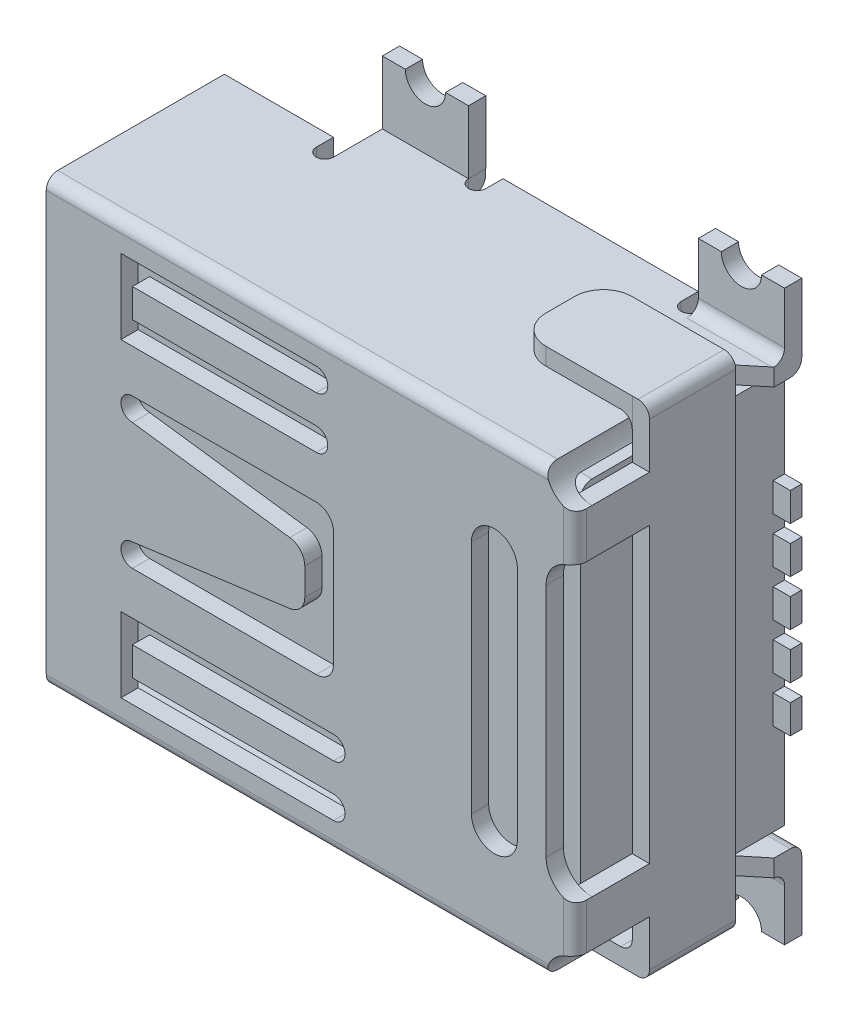
from build123d import *

# Parameters (mm, degrees)
EXTRUDE1_DEPTH       = 3.95
FILLET1_R            = 0.2
FILLET2_R            = 0.2
SKETCH2_W            = 3.65
SKETCH2_H            = 7.1
CUT_EXTRUDE1_DEPTH   = 9.2
FILLET5_R            = 0.2
FILLET9_R            = 0.2
SKETCH4_W            = 1.5
SKETCH4_H            = 0.3
EXTRUDE3_DEPTH       = 1.1
FILLET10_R           = 0.2
CUT_EXTRUDE2_DEPTH   = 0.3
SKETCH6_W            = 1.5
SKETCH6_H            = 0.3
EXTRUDE4_DEPTH       = 1.1
CUT_EXTRUDE4_DEPTH   = 0.3
CUT_EXTRUDE5_DEPTH   = 0.3
FILLET11_R           = 0.2
CUT_EXTRUDE6_DEPTH   = 0.3
FILLET12_R           = 0.2
SKETCH11_W           = 1
SKETCH11_H           = 0.8
EXTRUDE5_DEPTH       = 0.3
FILLET13_R           = 0.2
SKETCH12_W           = 1
SKETCH12_H           = 0.8
EXTRUDE6_DEPTH       = 0.3
FILLET14_R           = 0.2
EXTRUDE7_DEPTH       = 1.5
EXTRUDE8_DEPTH       = 1
SKETCH15_W           = 0.3
SKETCH15_H           = 1.5
EXTRUDE9_DEPTH       = 1
SKETCH16_W           = 1.500002194
SKETCH16_H           = 0.3
EXTRUDE10_DEPTH      = 2
FILLET15_R           = 0.2
FILLET17_R           = 0.2
SKETCH17_W           = 1.5
SKETCH17_H           = 0.3
EXTRUDE11_DEPTH      = 2
FILLET18_R           = 0.2
FILLET19_R           = 0.2
FILLET20_R           = 0.5
FILLET21_R           = 0.5
FILLET22_R           = 0.5
FILLET23_R           = 0.5
CUT_EXTRUDE8_DEPTH   = 0.3
CUT_EXTRUDE9_DEPTH   = 0.3
EXTRUDE12_DEPTH      = 0.3
EXTRUDE13_DEPTH      = 0.3
SKETCH22_W           = 1.5
SKETCH22_H           = 0.3
EXTRUDE14_DEPTH      = 1.1
CUT_EXTRUDE10_DEPTH  = 0.3
FILLET24_R           = 0.2
FILLET25_R           = 0.2
SKETCH24_W           = 1.5
SKETCH24_H           = 0.3
EXTRUDE15_DEPTH      = 1.1
CUT_EXTRUDE11_START  = -0.3
CUT_EXTRUDE11_DEPTH  = 0.3
CUT_EXTRUDE12_DEPTH  = 0.3
FILLET26_R           = 0.2
FILLET27_R           = 0.2
CUT_EXTRUDE13_DEPTH  = 0.3
SKETCH29_W           = 1.9
SKETCH29_H           = 0.025
EXTRUDE16_DEPTH      = 0.3
EXTRUDE17_DEPTH      = 8.9
EXTRUDE18_DEPTH      = 1
EXTRUDE18_DEPTH_BACK = 1
SKETCH31_R           = 0.346423802
CUT_EXTRUDE14_DEPTH  = 2.5
CUT_EXTRUDE15_DEPTH  = 1
SKETCH35_W           = 1.45
SKETCH35_H           = 0.4
EXTRUDE19_DEPTH      = 2
SKETCH36_W           = 1.05
SKETCH36_H           = 6.9
EXTRUDE20_DEPTH      = 7
SKETCH37_W           = 0.2
SKETCH37_H           = 0.5
CUT_EXTRUDE16_DEPTH  = 2
SKETCH38_W           = 2.3
SKETCH38_H           = 0.5
EXTRUDE21_DEPTH      = 0.2


with BuildPart() as part:
    # Sketch1 → Extrude1 (new body)
    with BuildSketch(Plane.XY):
        with BuildLine():
            Line((0, 0), (8.7, 0))
            ThreePointArc((8.7, 0), (8.846446609, 0.353553391), (9.2, 0.5))
            Line((9.2, 0.5), (9.2, 1.3))
            ThreePointArc((9.2, 1.3), (8.846446609, 1.446446609), (8.7, 1.8))
            Line((8.7, 1.8), (8.7, 5.9))
            ThreePointArc((8.7, 5.9), (8.846446609, 6.253553391), (9.2, 6.4))
            Line((9.2, 6.4), (9.2, 7.2))
            ThreePointArc((9.2, 7.2), (8.846446609, 7.346446609), (8.7, 7.7))
            Line((8.7, 7.7), (0, 7.7))
            Line((0, 7.7), (0, 0))
        make_face()
        with BuildLine():
            Line((8.2, 1.8), (8.2, 5.9))
            ThreePointArc((8.2, 5.9), (7.8, 6.3), (7.4, 5.9))
            Line((7.4, 5.9), (7.4, 1.8))
            ThreePointArc((7.4, 1.8), (7.8, 1.4), (8.2, 1.8))
        make_face(mode=Mode.SUBTRACT)
        with BuildLine():
            Line((5, 4.85), (5, 2.85))
            ThreePointArc((5, 2.85), (4.912132034, 2.637867966), (4.7, 2.55))
            Line((4.7, 2.55), (1.5, 2.55))
            ThreePointArc((1.5, 2.55), (1.3, 2.75), (1.5, 2.95))
            Line((1.5, 2.95), (4.239649116, 3.315286549))
            ThreePointArc((4.239649116, 3.315286549), (4.425715235, 3.41503753), (4.5, 3.612654919))
            Line((4.5, 3.612654919), (4.5, 4.087345081))
            ThreePointArc((4.5, 4.087345081), (4.425715235, 4.28496247), (4.239649116, 4.384713451))
            Line((4.239649116, 4.384713451), (1.5, 4.75))
            ThreePointArc((1.5, 4.75), (1.3, 4.95), (1.5, 5.15))
            Line((1.5, 5.15), (4.7, 5.15))
            ThreePointArc((4.7, 5.15), (4.912132034, 5.062132034), (5, 4.85))
        make_face(mode=Mode.SUBTRACT)
        with BuildLine():
            Line((1.3, 5.9), (4.7, 5.9))
            ThreePointArc((4.7, 5.9), (4.9, 6.1), (4.7, 6.3))
            Line((4.7, 6.3), (1.5, 6.3))
            Line((1.5, 6.3), (1.5, 6.8))
            Line((1.5, 6.8), (4.7, 6.8))
            ThreePointArc((4.7, 6.8), (4.9, 7), (4.7, 7.2))
            Line((4.7, 7.2), (1.3, 7.2))
            Line((1.3, 7.2), (1.3, 5.9))
        make_face(mode=Mode.SUBTRACT)
        with BuildLine():
            Line((5, 1.8), (1.3, 1.8))
            Line((1.3, 1.8), (1.3, 0.5))
            Line((1.3, 0.5), (5, 0.5))
            ThreePointArc((5, 0.5), (5.2, 0.7), (5, 0.9))
            Line((5, 0.9), (1.5, 0.9))
            Line((1.5, 0.9), (1.5, 1.4))
            Line((1.5, 1.4), (5, 1.4))
            ThreePointArc((5, 1.4), (5.2, 1.6), (5, 1.8))
        make_face(mode=Mode.SUBTRACT)
    extrude(amount=EXTRUDE1_DEPTH)

    # Fillet1
    fillet1_edges = [part.edges().sort_by_distance(p)[0] for p in [
        (4.35, 7.7, 3.95),
    ]]
    fillet(fillet1_edges, radius=FILLET1_R)

    # Fillet2
    fillet2_edges = [part.edges().sort_by_distance(p)[0] for p in [
        (4.35, 0, 3.95),
    ]]
    fillet(fillet2_edges, radius=FILLET2_R)

    # Sketch2 → Cut-Extrude1 (cut)
    with BuildSketch(Plane.ZY):
        with Locations((1.825, 3.85)):
            Rectangle(SKETCH2_W, SKETCH2_H)
    extrude(amount=-CUT_EXTRUDE1_DEPTH, mode=Mode.SUBTRACT)

    # Fillet5
    fillet5_edges = [part.edges().sort_by_distance(p)[0] for p in [
        (4.4, 7.4, 3.65),
    ]]
    fillet(fillet5_edges, radius=FILLET5_R - 0.0001)  # a hair under: the kernel refuses the full size

    # Fillet9
    fillet9_edges = [part.edges().sort_by_distance(p)[0] for p in [
        (4.4, 0.3, 3.65),
    ]]
    fillet(fillet9_edges, radius=FILLET9_R - 0.0001)  # a hair under: the kernel refuses the full size

    # Sketch4 → Extrude3 (add)
    with BuildSketch(Plane.XZ):
        with Locations((2.95, 0.15)):
            Rectangle(SKETCH4_W, SKETCH4_H)
    extrude(amount=EXTRUDE3_DEPTH)

    # Fillet10
    fillet10_edges = [part.edges().sort_by_distance(p)[0] for p in [
        (2.95, 0, 0.3),
    ]]
    fillet(fillet10_edges, radius=FILLET10_R)

    # Sketch5 → Cut-Extrude2 (cut)
    with BuildSketch(Plane.XZ):
        with BuildLine():
            Line((0, 0), (0, 0.85))
            Line((0, 0.85), (1.9, 0.85))
            Line((1.9, 0.85), (1.9, 1.35))
            ThreePointArc((1.9, 1.35), (2.05, 1.5), (2.2, 1.35))
            Line((2.2, 1.35), (2.2, 0))
            Line((2.2, 0), (0, 0))
        make_face()
    extrude(amount=-CUT_EXTRUDE2_DEPTH, mode=Mode.SUBTRACT)

    # Sketch6 → Extrude4 (add)
    with BuildSketch(Plane(origin=(0, 7.7, 0), x_dir=(-1, 0, 0), z_dir=(0, 1, 0))):
        with Locations((-2.95, 0.15)):
            Rectangle(SKETCH6_W, SKETCH6_H)
    extrude(amount=EXTRUDE4_DEPTH)

    # Sketch8 → Cut-Extrude4 (cut)
    with BuildSketch(Plane(origin=(0, 7.7, 0), x_dir=(-1, 0, 0), z_dir=(0, 1, 0))):
        with BuildLine():
            Line((0, 0), (0, 0.875))
            Line((0, 0.875), (-1.9, 0.875))
            Line((-1.9, 0.875), (-1.9, 1.15))
            ThreePointArc((-1.9, 1.15), (-2.05, 1.3), (-2.2, 1.15))
            Line((-2.2, 1.15), (-2.2, 0.3))
            Line((-2.2, 0.3), (-2.2, 0))
            Line((-2.2, 0), (0, 0))
        make_face()
    extrude(amount=-CUT_EXTRUDE4_DEPTH, mode=Mode.SUBTRACT)

    # Sketch9 → Cut-Extrude5 (cut)
    with BuildSketch(Plane.XZ):
        with BuildLine():
            Line((3.7, 0), (3.7, 0.5))
            ThreePointArc((3.7, 0.5), (3.85, 0.65), (4, 0.5))
            Line((4, 0.5), (4, 0))
            Line((4, 0), (3.7, 0))
        make_face()
    extrude(amount=-CUT_EXTRUDE5_DEPTH, mode=Mode.SUBTRACT)

    # Fillet11
    fillet11_edges = [part.edges().sort_by_distance(p)[0] for p in [
        (2.95, 0.3, 0),
    ]]
    fillet(fillet11_edges, radius=FILLET11_R)

    # Sketch10 → Cut-Extrude6 (cut)
    with BuildSketch(Plane(origin=(0, 7.7, 0), x_dir=(-1, 0, 0), z_dir=(0, 1, 0))):
        with BuildLine():
            Line((-3.696750436, 0), (-3.7, 0.3))
            ThreePointArc((-3.7, 0.3), (-3.851615888, 0.448366514), (-3.999982402, 0.296750627))
            Line((-3.999982402, 0.296750627), (-3.999982402, 0))
            Line((-3.999982402, 0), (-3.696750436, 0))
        make_face()
    extrude(amount=-CUT_EXTRUDE6_DEPTH, mode=Mode.SUBTRACT)

    # Fillet12
    fillet12_edges = [part.edges().sort_by_distance(p)[0] for p in [
        (2.948375218, 7.4, 0),
    ]]
    fillet(fillet12_edges, radius=FILLET12_R)

    # Sketch11 → Extrude5 (add)
    with BuildSketch(Plane(origin=(9.2, 0, 0), x_dir=(0, 0, -1), z_dir=(1, 0, 0))):
        with Locations((-3.15, 6.8)):
            Rectangle(SKETCH11_W, SKETCH11_H)
    extrude(amount=-EXTRUDE5_DEPTH)

    # Fillet13
    fillet13_edges = [part.edges().sort_by_distance(p)[0] for p in [
        (9.2, 6.8, 3.95),
    ]]
    fillet(fillet13_edges, radius=FILLET13_R)

    # Sketch12 → Extrude6 (add)
    with BuildSketch(Plane(origin=(9.2, 0, 0), x_dir=(0, 0, -1), z_dir=(1, 0, 0))):
        with Locations((-3.15, 0.9)):
            Rectangle(SKETCH12_W, SKETCH12_H)
    extrude(amount=-EXTRUDE6_DEPTH)

    # Fillet14
    fillet14_edges = [part.edges().sort_by_distance(p)[0] for p in [
        (9.2, 0.9, 3.95),
    ]]
    fillet(fillet14_edges, radius=FILLET14_R)

    # Sketch13 → Extrude7 (add)
    with BuildSketch(Plane(origin=(0, 0, 2.65), x_dir=(-1, 0, 0), z_dir=(0, 0, -1))):
        Polygon((-9.2, 6.4), (-9.2, 1.3), (-9.2, 0.5), (-8.9, 0.5), (-8.9, 6.4), (-8.9, 7.2), (-9.2, 7.2), align=None)
    extrude(amount=EXTRUDE7_DEPTH)

    # Sketch14 → Extrude8 (add)
    with BuildSketch(Plane(origin=(0, 7.2, 0), x_dir=(-1, 0, 0), z_dir=(0, 1, 0))):
        Polygon((-9.2, 1.15), (-9.2, 2.65), (-8.9, 2.65), (-8.897434104, 1.15), align=None)
    extrude(amount=EXTRUDE8_DEPTH)

    # Sketch15 → Extrude9 (add)
    with BuildSketch(Plane.XZ.offset(-0.5)):
        with Locations((9.05, 1.9)):
            Rectangle(SKETCH15_W, SKETCH15_H)
    extrude(amount=EXTRUDE9_DEPTH)

    # Sketch16 → Extrude10 (add)
    with BuildSketch(Plane(origin=(8.895440887, 0, -0.015216519), x_dir=(0.0017105950011207093, 0, 0.9999985369313008), z_dir=(-0.9999985369313008, 2.168401172446543e-15, 0.0017105950011207093))):
        with Locations((1.915219321, 8.05)):
            Rectangle(SKETCH16_W, SKETCH16_H)
    extrude(amount=EXTRUDE10_DEPTH)

    # Fillet15
    fillet15_edges = [part.edges().sort_by_distance(p)[0] for p in [
        (9.2, 8.2, 1.9),
    ]]
    fillet(fillet15_edges, radius=FILLET15_R)

    # Fillet17
    fillet17_edges = [part.edges().sort_by_distance(p)[0] for p in [
        (8.898717052, 7.9, 1.9),
    ]]
    fillet(fillet17_edges, radius=FILLET17_R)

    # Sketch17 → Extrude11 (add)
    with BuildSketch(Plane.ZY.offset(-8.9)):
        with Locations((1.9, -0.35)):
            Rectangle(SKETCH17_W, SKETCH17_H)
    extrude(amount=EXTRUDE11_DEPTH)

    # Fillet18
    fillet18_edges = [part.edges().sort_by_distance(p)[0] for p in [
        (8.9, -0.2, 1.9),
    ]]
    fillet(fillet18_edges, radius=FILLET18_R)

    # Fillet19
    fillet19_edges = [part.edges().sort_by_distance(p)[0] for p in [
        (9.2, -0.5, 1.9),
    ]]
    fillet(fillet19_edges, radius=FILLET19_R)

    # Fillet20
    fillet20_edges = [part.edges().sort_by_distance(p)[0] for p in [
        (6.9, -0.35, 2.65),
    ]]
    fillet(fillet20_edges, radius=FILLET20_R)

    # Fillet21
    fillet21_edges = [part.edges().sort_by_distance(p)[0] for p in [
        (6.9, -0.35, 1.15),
    ]]
    fillet(fillet21_edges, radius=FILLET21_R)

    # Fillet22
    fillet22_edges = [part.edges().sort_by_distance(p)[0] for p in [
        (6.89743703, 8.05, 1.15342119),
    ]]
    fillet(fillet22_edges, radius=FILLET22_R)

    # Fillet23
    fillet23_edges = [part.edges().sort_by_distance(p)[0] for p in [
        (6.900002926, 8.05, 2.65342119),
    ]]
    fillet(fillet23_edges, radius=FILLET23_R)

    # Sketch18 → Cut-Extrude8 (cut)
    with BuildSketch(Plane.XY.offset(0.3)):
        with BuildLine():
            Line((2.6, -1.1), (3.3, -1.1))
            ThreePointArc((3.3, -1.1), (2.95, -0.75), (2.6, -1.1))
        make_face()
    extrude(amount=-CUT_EXTRUDE8_DEPTH, mode=Mode.SUBTRACT)

    # Sketch19 → Cut-Extrude9 (cut)
    with BuildSketch(Plane.XY.offset(0.3)):
        with BuildLine():
            Line((3.3, 8.8), (2.6, 8.8))
            ThreePointArc((2.6, 8.8), (2.95, 8.45), (3.3, 8.8))
        make_face()
    extrude(amount=-CUT_EXTRUDE9_DEPTH, mode=Mode.SUBTRACT)

    # Sketch20 → Extrude12 (add)
    with BuildSketch(Plane.XZ):
        Polygon((8.7, 0), (9.2, 0), (9.2, 0.479642433), (8.7, 0.889754561), align=None)
    extrude(amount=-EXTRUDE12_DEPTH)

    # Sketch21 → Extrude13 (add)
    with BuildSketch(Plane(origin=(0, 7.7, 0), x_dir=(-1, 0, 0), z_dir=(0, 1, 0))):
        Polygon((-8.7, 0), (-9.2, 0), (-9.2, 0.479642433), (-8.7, 0.895293977), align=None)
    extrude(amount=-EXTRUDE13_DEPTH)

    # Sketch22 → Extrude14 (add)
    with BuildSketch(Plane(origin=(0, 7.7, 0), x_dir=(-1, 0, 0), z_dir=(0, 1, 0))):
        with Locations((-8.45, 0.15)):
            Rectangle(SKETCH22_W, SKETCH22_H)
    extrude(amount=EXTRUDE14_DEPTH)

    # Sketch23 → Cut-Extrude10 (cut)
    with BuildSketch(Plane(origin=(0, 7.7, 0), x_dir=(-1, 0, 0), z_dir=(0, 1, 0))):
        with BuildLine():
            Line((-7.7, 0), (-7.7, 0.3))
            ThreePointArc((-7.7, 0.3), (-7.55, 0.45), (-7.4, 0.3))
            Line((-7.4, 0.3), (-7.4, 0))
            Line((-7.4, 0), (-7.7, 0))
        make_face()
    extrude(amount=-CUT_EXTRUDE10_DEPTH, mode=Mode.SUBTRACT)

    # Fillet24
    fillet24_edges = [part.edges().sort_by_distance(p)[0] for p in [
        (8.45, 7.7, 0.3),
    ]]
    fillet(fillet24_edges, radius=FILLET24_R)

    # Fillet25
    fillet25_edges = [part.edges().sort_by_distance(p)[0] for p in [
        (8.45, 7.4, 0),
    ]]
    fillet(fillet25_edges, radius=FILLET25_R)

    # Sketch24 → Extrude15 (add)
    with BuildSketch(Plane.XZ):
        with Locations((8.45, 0.15)):
            Rectangle(SKETCH24_W, SKETCH24_H)
    extrude(amount=EXTRUDE15_DEPTH)

    # Sketch25 → Cut-Extrude11 (cut)
    with BuildSketch(Plane.XZ.offset(CUT_EXTRUDE11_START)):
        with BuildLine():
            Line((7.7, 0), (7.7, 0.3))
            ThreePointArc((7.7, 0.3), (7.55, 0.45), (7.4, 0.3))
            Line((7.4, 0.3), (7.4, 0))
            Line((7.4, 0), (7.7, 0))
        make_face()
    extrude(amount=CUT_EXTRUDE11_DEPTH, mode=Mode.SUBTRACT)

    # Sketch26 → Cut-Extrude12 (cut)
    with BuildSketch(Plane.XY.offset(0.3)):
        with BuildLine():
            Line((8.1, -1.1), (8.8, -1.1))
            ThreePointArc((8.8, -1.1), (8.45, -0.75), (8.1, -1.1))
        make_face()
    extrude(amount=-CUT_EXTRUDE12_DEPTH, mode=Mode.SUBTRACT)

    # Fillet26
    fillet26_edges = [part.edges().sort_by_distance(p)[0] for p in [
        (8.45, 0, 0.3),
    ]]
    fillet(fillet26_edges, radius=FILLET26_R)

    # Fillet27
    fillet27_edges = [part.edges().sort_by_distance(p)[0] for p in [
        (8.45, 0.3, 0),
    ]]
    fillet(fillet27_edges, radius=FILLET27_R)

    # Sketch27 → Cut-Extrude13 (cut)
    with BuildSketch(Plane.XY.offset(0.3)):
        with BuildLine():
            Line((8.8, 8.8), (8.1, 8.8))
            ThreePointArc((8.1, 8.8), (8.45, 8.45), (8.8, 8.8))
        make_face()
    extrude(amount=-CUT_EXTRUDE13_DEPTH, mode=Mode.SUBTRACT)

    # Sketch29 → Extrude16 (add)
    with BuildSketch(Plane(origin=(0, 7.7, 0), x_dir=(-1, 0, 0), z_dir=(0, 1, 0))):
        with Locations((-0.95, 0.8625)):
            Rectangle(SKETCH29_W, SKETCH29_H)
    extrude(amount=-EXTRUDE16_DEPTH)

    # Sketch30 → Extrude17 (add)
    with BuildSketch(Plane.ZY):
        with BuildLine():
            Line((0.85, 7.1), (0.85, 6.382842712))
            ThreePointArc((0.85, 6.382842712), (0.834775907, 6.306306026), (0.791421356, 6.241421356))
            Line((0.791421356, 6.241421356), (0.058578644, 5.508578644))
            ThreePointArc((0.058578644, 5.508578644), (0.015224093, 5.443693974), (0, 5.367157288))
            Line((0, 5.367157288), (0, 2.332842712))
            ThreePointArc((0, 2.332842712), (0.015224093, 2.256306026), (0.058578644, 2.191421356))
            Line((0.058578644, 2.191421356), (0.791421356, 1.458578644))
            ThreePointArc((0.791421356, 1.458578644), (0.834775907, 1.393693974), (0.85, 1.317157288))
            Line((0.85, 1.317157288), (0.85, 0.6))
            ThreePointArc((0.85, 0.6), (0.908578644, 0.458578644), (1.05, 0.4))
            Line((1.05, 0.4), (3.35, 0.4))
            ThreePointArc((3.35, 0.4), (3.491421356, 0.458578644), (3.55, 0.6))
            Line((3.55, 0.6), (3.55, 7.1))
            ThreePointArc((3.55, 7.1), (3.491421356, 7.241421356), (3.35, 7.3))
            Line((3.35, 7.3), (1.05, 7.3))
            ThreePointArc((1.05, 7.3), (0.908578644, 7.241421356), (0.85, 7.1))
        make_face()
    extrude(amount=-EXTRUDE17_DEPTH)

    # Sketch31 → Extrude18 (add, two sides: drawn at the far end of the back side and taken through both)
    with BuildSketch(Plane(origin=(0, 0, 0), x_dir=(-1, 0, 0), z_dir=(0, 0, -1)).offset(-EXTRUDE18_DEPTH_BACK)):
        with Locations(Location((-5.9, 6.05, 0), (0, 0, 33.543099328))):
            Circle(SKETCH31_R)
        with Locations(Location((-5.9, 1.65, 0), (0, 0, 253.903545802))):
            Circle(SKETCH31_R)
    extrude(amount=EXTRUDE18_DEPTH + EXTRUDE18_DEPTH_BACK)

    # Sketch33 → Cut-Extrude14 (cut)
    with BuildSketch(Plane.ZY):
        with BuildLine():
            Line((1.15, 7.2), (3.25, 7.2))
            ThreePointArc((3.25, 7.2), (3.391421356, 7.141421356), (3.45, 7))
            Line((3.45, 7), (3.45, 0.7))
            ThreePointArc((3.45, 0.7), (3.391421356, 0.558578644), (3.25, 0.5))
            Line((3.25, 0.5), (1.15, 0.5))
            ThreePointArc((1.15, 0.5), (1.008578644, 0.558578644), (0.95, 0.7))
            Line((0.95, 0.7), (0.95, 1.358578644))
            ThreePointArc((0.95, 1.358578644), (0.934775907, 1.43511533), (0.891421356, 1.5))
            Line((0.891421356, 1.5), (0.158578644, 2.232842712))
            ThreePointArc((0.158578644, 2.232842712), (0.115224093, 2.297727382), (0.1, 2.374264069))
            Line((0.1, 2.374264069), (0.1, 5.325735931))
            ThreePointArc((0.1, 5.325735931), (0.115224093, 5.402272618), (0.158578644, 5.467157288))
            Line((0.158578644, 5.467157288), (0.891421356, 6.2))
            ThreePointArc((0.891421356, 6.2), (0.934775907, 6.26488467), (0.95, 6.341421356))
            Line((0.95, 6.341421356), (0.95, 7))
            ThreePointArc((0.95, 7), (1.008578644, 7.141421356), (1.15, 7.2))
        make_face()
        Polygon((1.521033648, 2.18), (1.521033648, 2.58), (2.821033648, 2.58), (2.821033648, 2.93), (1.521033648, 2.93), (1.521033648, 3.33), (2.821033648, 3.33), (2.821033648, 3.66), (1.521033648, 3.66), (1.521033648, 4.06), (2.821033648, 4.06), (2.821033648, 4.39), (1.521033648, 4.39), (1.521033648, 4.79), (2.821033648, 4.79), (2.821033648, 5.12), (1.521033648, 5.12), (1.521033648, 5.52), (2.821033648, 5.52), (2.821033648, 5.85), (1.521033648, 5.85), (0.95, 5.3), (0.95, 2.4), (1.521033648, 1.85), (2.821033648, 1.85), (2.821033648, 2.18), align=None, mode=Mode.SUBTRACT)
    extrude(amount=-CUT_EXTRUDE14_DEPTH, mode=Mode.SUBTRACT)

    # Sketch34 → Cut-Extrude15 (cut)
    with BuildSketch(Plane.ZY):
        Polygon((2.821033648, 5.85), (2.821033648, 5.52), (1.521033648, 5.52), (1.521033648, 5.12), (2.821033648, 5.12), (2.821033648, 4.79), (1.521033648, 4.79), (1.521033648, 4.39), (2.821033648, 4.39), (2.821033648, 4.06), (1.521033648, 4.06), (1.521033648, 3.66), (2.821033648, 3.66), (2.821033648, 3.33), (1.521033648, 3.33), (1.521033648, 2.93), (2.821033648, 2.93), (2.821033648, 2.58), (1.521033648, 2.58), (1.521033648, 2.18), (2.821033648, 2.18), (2.821033648, 1.85), (1.521033648, 1.85), (0.95, 2.4), (0.95, 5.3), (1.521033648, 5.85), align=None)
    extrude(amount=-CUT_EXTRUDE15_DEPTH, mode=Mode.SUBTRACT)

    # Sketch35 → Extrude19 (add)
    with BuildSketch(Plane.ZY.offset(-2.5)):
        Polygon((1.521033648, 5.52), (2.971033648, 5.52), (2.971033648, 5.12), (2.821033648, 5.12), (1.521033648, 5.12), align=None)
        with Locations((2.246033648, 3.86)):
            Rectangle(SKETCH35_W, SKETCH35_H)
        with Locations((2.246033648, 4.59)):
            Rectangle(SKETCH35_W, SKETCH35_H)
        with Locations((2.246033648, 3.13)):
            Rectangle(SKETCH35_W, SKETCH35_H)
        with Locations((2.246033648, 2.38)):
            Rectangle(SKETCH35_W, SKETCH35_H)
    extrude(amount=EXTRUDE19_DEPTH)

    # Sketch36 → Extrude20 (add)
    with BuildSketch(Plane(origin=(8.9, 0, 0), x_dir=(0, 0, -1), z_dir=(1, 0, 0))):
        with Locations((-0.525, 3.85)):
            Rectangle(SKETCH36_W, SKETCH36_H)
    extrude(amount=-EXTRUDE20_DEPTH)

    # Sketch37 → Cut-Extrude16 (cut)
    with BuildSketch(Plane(origin=(8.9, 0, 0), x_dir=(0, 0, -1), z_dir=(1, 0, 0))):
        with Locations((-0.1, 4.65)):
            Rectangle(SKETCH37_W, SKETCH37_H)
        with Locations((-0.1, 3.85)):
            Rectangle(SKETCH37_W, SKETCH37_H)
        with Locations((-0.1, 5.45)):
            Rectangle(SKETCH37_W, SKETCH37_H)
        with Locations((-0.1, 3.05)):
            Rectangle(SKETCH37_W, SKETCH37_H)
        with Locations((-0.1, 2.25)):
            Rectangle(SKETCH37_W, SKETCH37_H)
    extrude(amount=-CUT_EXTRUDE16_DEPTH, mode=Mode.SUBTRACT)

    # Sketch38 → Extrude21 (add)
    with BuildSketch(Plane(origin=(0, 0, 0.2), x_dir=(-1, 0, 0), z_dir=(0, 0, -1))):
        with Locations((-8.05, 5.45)):
            Rectangle(SKETCH38_W, SKETCH38_H)
        with Locations((-8.05, 4.65)):
            Rectangle(SKETCH38_W, SKETCH38_H)
        with Locations((-8.05, 3.85)):
            Rectangle(SKETCH38_W, SKETCH38_H)
        with Locations((-8.05, 3.05)):
            Rectangle(SKETCH38_W, SKETCH38_H)
        with Locations((-8.05, 2.25)):
            Rectangle(SKETCH38_W, SKETCH38_H)
    extrude(amount=EXTRUDE21_DEPTH)


solid = part.part
